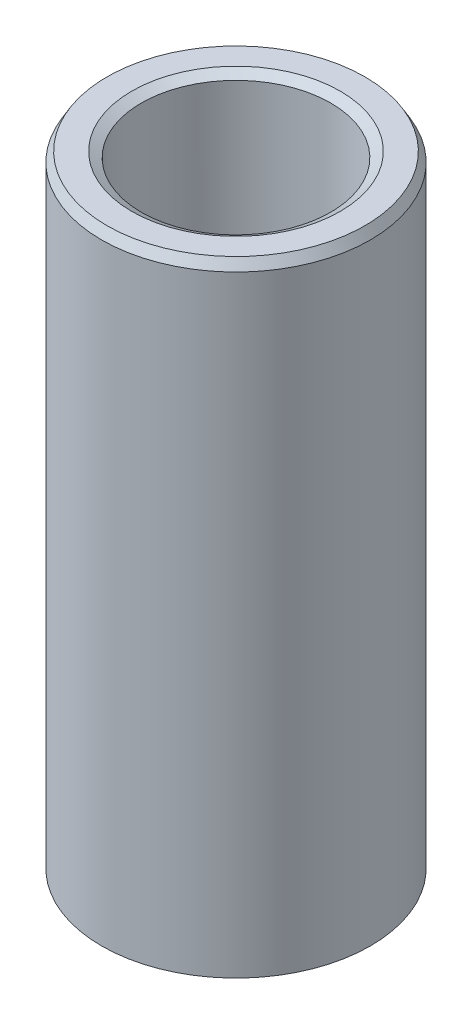
from build123d import *
from OCP.BRepFilletAPI import BRepFilletAPI_MakeChamfer

# Parameters (mm, degrees)
SKETCH1_R           = 52.5
BOSS_EXTRUDE1_DEPTH = 244.614480407
SKETCH2_R           = 36.966692484
CUT_EXTRUDE1_DEPTH  = 256.634004046
CHAMFER1_SIZE       = 3.72583585
CHAMFER1_SIZE2      = 2.151112331


with BuildPart() as part:
    # Sketch1 → Boss-Extrude1 (new body)
    with BuildSketch(Plane(origin=(0, 0, 0), x_dir=(1, 0, 0), z_dir=(0, 1, 0))):
        Circle(SKETCH1_R)
    extrude(amount=BOSS_EXTRUDE1_DEPTH)

    # Sketch2 → Cut-Extrude1 (cut, through all)
    with BuildSketch(Plane(origin=(0, 0, 0), x_dir=(1, 0, 0), z_dir=(0, 1, 0))):
        Circle(SKETCH2_R)
    extrude(amount=CUT_EXTRUDE1_DEPTH, mode=Mode.SUBTRACT)

    # Chamfer1: one chamfer whose edges measure the first distance from different faces: ONE call of the kernel's chamfer builder (chamfer() names one face for all edges)
    chamfer1_edges_1 = [part.edges().sort_by_distance(p)[0] for p in [
        (-36.966692484, 244.614480407, 0),
    ]]
    chamfer1_side_1 = [part.faces().sort_by_distance(p)[0] for p in [
        (-51.01507576, 244.614480407, 0),
    ]]
    chamfer1_edges_2 = [part.edges().sort_by_distance(p)[0] for p in [
        (-36.966692484, 0, 0),
    ]]
    chamfer1_side_2 = [part.faces().sort_by_distance(p)[0] for p in [
        (-36.966692484, 122.307240203, 0),
    ]]
    chamfer1_edges_3 = [part.edges().sort_by_distance(p)[0] for p in [
        (-52.5, 0, 0),
    ]]
    chamfer1_side_3 = [part.faces().sort_by_distance(p)[0] for p in [
        (-51.01507576, 0, 0),
    ]]
    chamfer1_edges_4 = [part.edges().sort_by_distance(p)[0] for p in [
        (-52.5, 244.614480407, 0),
    ]]
    chamfer1_side_4 = [part.faces().sort_by_distance(p)[0] for p in [
        (-52.5, 122.307240203, 0),
    ]]
    chamfer1 = BRepFilletAPI_MakeChamfer(part.part.solid().wrapped)
    for e in chamfer1_edges_1:
        chamfer1.Add(CHAMFER1_SIZE, CHAMFER1_SIZE2, e.wrapped, chamfer1_side_1[0].wrapped)  # the first distance lies on this face
    for e in chamfer1_edges_2:
        chamfer1.Add(CHAMFER1_SIZE, CHAMFER1_SIZE2, e.wrapped, chamfer1_side_2[0].wrapped)  # the first distance lies on this face
    for e in chamfer1_edges_3:
        chamfer1.Add(CHAMFER1_SIZE, CHAMFER1_SIZE2, e.wrapped, chamfer1_side_3[0].wrapped)  # the first distance lies on this face
    for e in chamfer1_edges_4:
        chamfer1.Add(CHAMFER1_SIZE, CHAMFER1_SIZE2, e.wrapped, chamfer1_side_4[0].wrapped)  # the first distance lies on this face
    add(Compound.cast(chamfer1.Shape()), mode=Mode.REPLACE)


solid = part.part
